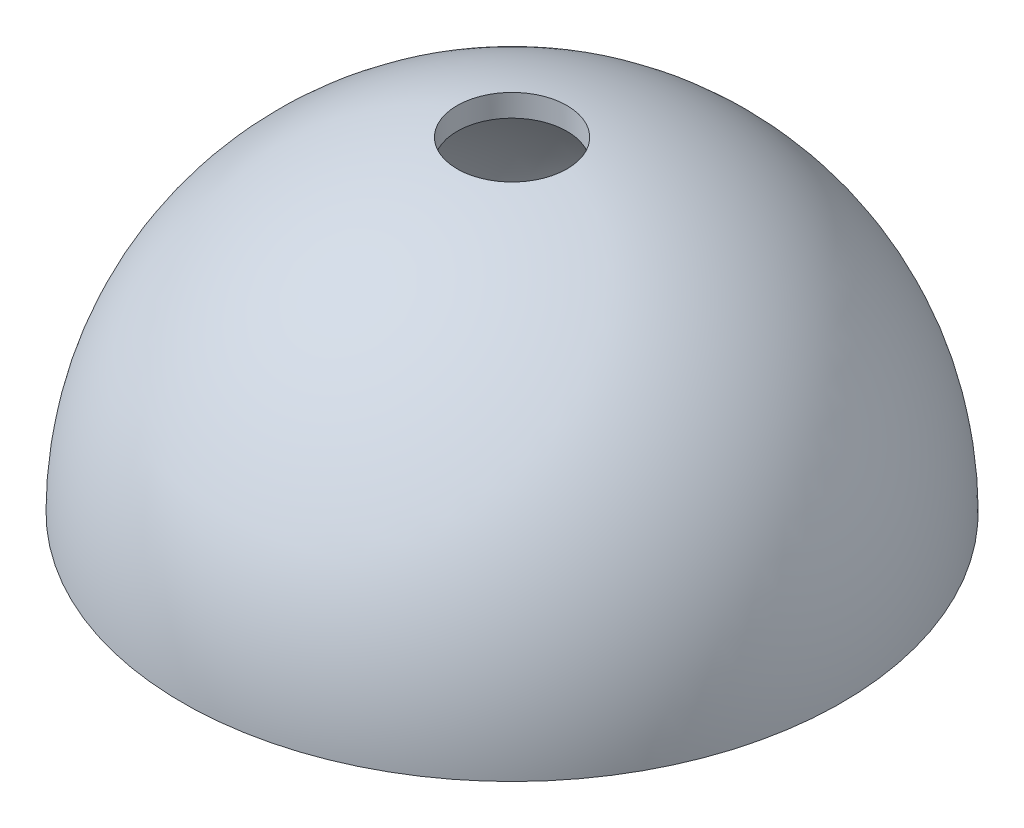
from build123d import *

# Parameters (mm, degrees)
SHELL1_T                = -10
CUT_EXTRUDE3_DEPTH      = 260.807621135
CUT_EXTRUDE3_DEPTH_BACK = 260.807621135
SKETCH2_R               = 25


with BuildPart() as part:
    # Sketch1 → Revolve1 (revolve)
    with BuildSketch(Plane.XY):
        with BuildLine():
            Line((0, 0), (0, 150))
            ThreePointArc((0, 150), (-106.066017178, 106.066017178), (-150, 0))
            Line((-150, 0), (0, 0))
        make_face()
    revolve(axis=Axis((0, 0, 0), (0, 1, 0)))

    # Shell1
    shell1_openings = [part.faces().sort_by_distance(p)[0] for p in [
        (0, 0, 0),
    ]]
    offset(amount=SHELL1_T, openings=shell1_openings, kind=Kind.INTERSECTION)

    # Sketch2 → Cut-Extrude3 (cut, two sides: drawn at the far end of the back side and taken through both)
    with BuildSketch(Plane(origin=(0, 0, 0), x_dir=(1, 0, 0), z_dir=(0, 1, 0)).offset(-CUT_EXTRUDE3_DEPTH_BACK)):
        Circle(SKETCH2_R)
    extrude(amount=CUT_EXTRUDE3_DEPTH + CUT_EXTRUDE3_DEPTH_BACK, mode=Mode.SUBTRACT)


solid = part.part
